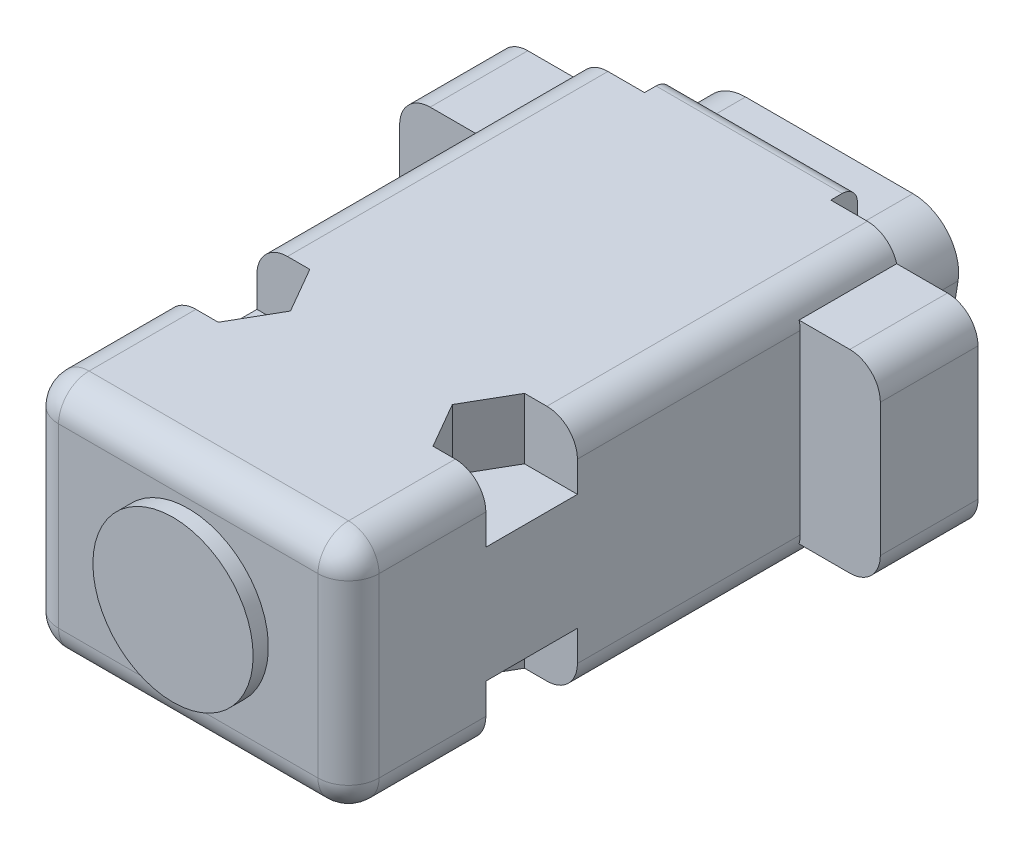
from build123d import *

# Parameters (mm, degrees)
EXTRUDE_1_DEPTH     = 7.8
SKETCH_3_R          = 5.25
EXTRUDE_2_DEPTH     = 1
SKETCH_5_W          = 31.5
SKETCH_5_H          = 6.4
EXTRUDE_3_DEPTH     = 6.35
EXTRUDE_4_DEPTH     = 6
FILLET_1_R          = 3
FILLET_2_R          = 2
FILLET_3_R          = 1
CUT_EXTRUDE_1_DEPTH = 4


with BuildPart() as part:
    # 草图1 → 凸台-拉伸1 (new, symmetric)
    with BuildSketch(Plane(origin=(0, 0, 0), x_dir=(1, 0, 0), z_dir=(0, 1, 0))):
        Polygon((-6.1, 18), (-10.5, 18), (-10.5, -18), (10.5, -18), (10.5, 18), (6.1, 18), (6.1, 19.75), (-6.1, 19.75), align=None)
    extrude(amount=EXTRUDE_1_DEPTH, both=True)

    # 草图3 → 凸台-拉伸2 (add)
    with BuildSketch(Plane.XY.offset(18)):
        with Locations(Location((0, 0, 0), (0, 0, 180))):
            Circle(SKETCH_3_R)
    extrude(amount=EXTRUDE_2_DEPTH)

    # 草图5 → 凸台-拉伸3 (add, symmetric)
    with BuildSketch(Plane(origin=(0, 0, 0), x_dir=(1, 0, 0), z_dir=(0, 1, 0))):
        with Locations((0, 14.8)):
            Rectangle(SKETCH_5_W, SKETCH_5_H)
    extrude(amount=EXTRUDE_3_DEPTH, both=True)

    # 草图6 → 凸台-拉伸4 (add)
    with BuildSketch(Plane(origin=(0, 0, -18), x_dir=(-1, 0, 0), z_dir=(0, 0, -1))):
        Polygon((-9, 4.85990087), (9, 4.85990087), (7.5, -4.54009913), (-7.5, -4.54009913), align=None)
    extrude(amount=EXTRUDE_4_DEPTH)

    # 圆角1
    fillet_1_edges = [part.edges().sort_by_distance(p)[0] for p in [
        (-7.5, -4.54009913, -21),
        (7.5, -4.54009913, -21),
        (9, 4.85990087, -21),
        (-9, 4.85990087, -21),
    ]]
    fillet(fillet_1_edges, radius=FILLET_1_R)

    # 圆角2
    # the kernel refuses this fillet: 2 mm, written as the material it takes off along each edge
    with BuildSketch(Plane(origin=(-8.5, -5.8, 16), x_dir=(-1, 0, 0), z_dir=(0, -1, 0))) as fillet_2_piece_1_section:
        Polygon((0, 0), (FILLET_2_R, 0), (FILLET_2_R, -FILLET_2_R), (0, -FILLET_2_R), align=None)
    fillet_2_piece_1 = extrude(amount=FILLET_2_R, mode=Mode.PRIVATE)
    fillet_2_piece_1 = fillet_2_piece_1 - Plane(origin=(-8.5, -5.8, 16), x_dir=(0.7071067811865474, 0, -0.7071067811865476), z_dir=(0, -1, 0)) * Sphere(FILLET_2_R, mode=Mode.PRIVATE)
    add(fillet_2_piece_1, mode=Mode.SUBTRACT)
    with BuildSketch(Plane(origin=(8.5, -5.8, 16), x_dir=(0, -1, 0), z_dir=(1, 0, 0))) as fillet_2_piece_2_section:
        Polygon((0, 0), (FILLET_2_R, 0), (FILLET_2_R, -FILLET_2_R), (0, -FILLET_2_R), align=None)
    fillet_2_piece_2 = extrude(amount=FILLET_2_R, mode=Mode.PRIVATE)
    fillet_2_piece_2 = fillet_2_piece_2 - Plane(origin=(8.5, -5.8, 16), x_dir=(0, 0.7071067811865475, -0.7071067811865475), z_dir=(1, 0, 0)) * Sphere(FILLET_2_R, mode=Mode.PRIVATE)
    add(fillet_2_piece_2, mode=Mode.SUBTRACT)
    with BuildSketch(Plane(origin=(8.5, 5.8, 16), x_dir=(0, 1, 0), z_dir=(1, 0, 0))) as fillet_2_piece_3_section:
        Polygon((0, 0), (FILLET_2_R, 0), (FILLET_2_R, FILLET_2_R), (0, FILLET_2_R), align=None)
    fillet_2_piece_3 = extrude(amount=FILLET_2_R, mode=Mode.PRIVATE)
    fillet_2_piece_3 = fillet_2_piece_3 - Plane(origin=(8.5, 5.8, 16), x_dir=(0, -0.7071067811865475, -0.7071067811865475), z_dir=(1, 0, 0)) * Sphere(FILLET_2_R, mode=Mode.PRIVATE)
    add(fillet_2_piece_3, mode=Mode.SUBTRACT)
    with BuildSketch(Plane(origin=(-8.5, 5.8, 16), x_dir=(-1, 0, 0), z_dir=(0, 1, 0))) as fillet_2_piece_4_section:
        Polygon((0, 0), (FILLET_2_R, 0), (FILLET_2_R, FILLET_2_R), (0, FILLET_2_R), align=None)
    fillet_2_piece_4 = extrude(amount=FILLET_2_R, mode=Mode.PRIVATE)
    fillet_2_piece_4 = fillet_2_piece_4 - Plane(origin=(-8.5, 5.8, 16), x_dir=(0.7071067811865474, 0, -0.7071067811865476), z_dir=(0, 1, 0)) * Sphere(FILLET_2_R, mode=Mode.PRIVATE)
    add(fillet_2_piece_4, mode=Mode.SUBTRACT)
    with BuildSketch(Plane(origin=(-8.5, -7.8, 18), x_dir=(0, 0, -1), z_dir=(1, 0, 0))) as fillet_2_piece_5:
        with BuildLine():
            CenterArc((FILLET_2_R, FILLET_2_R), FILLET_2_R, 180, 90)
            Line((0, FILLET_2_R), (0, 0))
            Line((0, 0), (FILLET_2_R, 0))
        make_face()
    extrude(amount=17, mode=Mode.SUBTRACT)
    with BuildSketch(Plane(origin=(10.5, -5.8, 18), x_dir=(-1, 0, 0), z_dir=(0, 1, 0)), Plane(origin=(-10.5, -5.8, 18), x_dir=(0, 0, -1), z_dir=(0, 1, 0))) as fillet_2_piece_6:
        with BuildLine():
            CenterArc((FILLET_2_R, -FILLET_2_R), FILLET_2_R, 90, 90)
            Line((0, -FILLET_2_R), (0, 0))
            Line((0, 0), (FILLET_2_R, 0))
        make_face()
    extrude(amount=11.6, mode=Mode.SUBTRACT)
    with BuildSketch(Plane(origin=(-8.5, 7.8, 18), x_dir=(0, 0, -1), z_dir=(1, 0, 0))) as fillet_2_piece_7:
        with BuildLine():
            CenterArc((FILLET_2_R, -FILLET_2_R), FILLET_2_R, 90, 90)
            Line((0, -FILLET_2_R), (0, 0))
            Line((0, 0), (FILLET_2_R, 0))
        make_face()
    extrude(amount=17, mode=Mode.SUBTRACT)
    with BuildSketch(Plane(origin=(-10.5, -7.8, -23), x_dir=(1, 0, 0), z_dir=(0, 0, 1))) as fillet_2_piece_8_section:
        with BuildLine():
            CenterArc((FILLET_2_R, FILLET_2_R), FILLET_2_R, 180, 90)
            Line((0, FILLET_2_R), (0, 0))
            Line((0, 0), (FILLET_2_R, 0))
        make_face()
    fillet_2_piece_8 = extrude(amount=39, mode=Mode.PRIVATE)
    fillet_2_piece_8 = split(fillet_2_piece_8, bisect_by=Plane(origin=(-10.030513344, -6.35, -17.3), z_dir=(0, -1, 0)), keep=Keep.TOP, mode=Mode.PRIVATE)
    fillet_2_piece_8 = split(fillet_2_piece_8, bisect_by=Plane(origin=(-10.030513344, -7.391821247, -11.6), z_dir=(0, 0, -1)), keep=Keep.TOP, mode=Mode.PRIVATE)
    add(fillet_2_piece_8, mode=Mode.SUBTRACT)
    with BuildSketch(Plane(origin=(-10.5, -7.8, -23), x_dir=(1, 0, 0), z_dir=(0, 0, 1))) as fillet_2_piece_9_section:
        with BuildLine():
            CenterArc((FILLET_2_R, FILLET_2_R), FILLET_2_R, 180, 90)
            Line((0, FILLET_2_R), (0, 0))
            Line((0, 0), (FILLET_2_R, 0))
        make_face()
    fillet_2_piece_9 = extrude(amount=39, mode=Mode.PRIVATE)
    fillet_2_piece_9 = split(fillet_2_piece_9, bisect_by=Plane(origin=(-10.030513344, -6.35, 2.2), z_dir=(0, -1, 0)), keep=Keep.TOP, mode=Mode.PRIVATE)
    fillet_2_piece_9 = split(fillet_2_piece_9, bisect_by=Plane(origin=(-10.030513344, -7.391821247, -11.6), z_dir=(0, 0, 1)), keep=Keep.TOP, mode=Mode.PRIVATE)
    add(fillet_2_piece_9, mode=Mode.SUBTRACT)
    with BuildSketch(Plane(origin=(-10.5, -7.8, -23), x_dir=(1, 0, 0), z_dir=(0, 0, 1))) as fillet_2_piece_10_section:
        with BuildLine():
            CenterArc((FILLET_2_R, FILLET_2_R), FILLET_2_R, 180, 90)
            Line((0, FILLET_2_R), (0, 0))
            Line((0, 0), (FILLET_2_R, 0))
        make_face()
    fillet_2_piece_10 = extrude(amount=39, mode=Mode.PRIVATE)
    fillet_2_piece_10 = split(fillet_2_piece_10, bisect_by=Plane(origin=(-10.503237221, -6.35, 2.2), z_dir=(0, 1, 0)), keep=Keep.TOP, mode=Mode.PRIVATE)
    fillet_2_piece_10 = split(fillet_2_piece_10, bisect_by=Plane(origin=(-10.503237221, -6.128742069, -11.6), z_dir=(0, 0, 1)), keep=Keep.TOP, mode=Mode.PRIVATE)
    add(fillet_2_piece_10, mode=Mode.SUBTRACT)
    with BuildSketch(Plane(origin=(-10.5, 7.8, -23), x_dir=(0, -1, 0), z_dir=(0, 0, 1))) as fillet_2_piece_11_section:
        with BuildLine():
            CenterArc((FILLET_2_R, FILLET_2_R), FILLET_2_R, 180, 90)
            Line((0, FILLET_2_R), (0, 0))
            Line((0, 0), (FILLET_2_R, 0))
        make_face()
    fillet_2_piece_11 = extrude(amount=39, mode=Mode.PRIVATE)
    fillet_2_piece_11 = split(fillet_2_piece_11, bisect_by=Plane(origin=(-10.030513344, 7.391821247, -11.6), z_dir=(0, 0, -1)), keep=Keep.TOP, mode=Mode.PRIVATE)
    fillet_2_piece_11 = split(fillet_2_piece_11, bisect_by=Plane(origin=(-10.030513344, 6.35, -17.3), z_dir=(0, 1, 0)), keep=Keep.TOP, mode=Mode.PRIVATE)
    add(fillet_2_piece_11, mode=Mode.SUBTRACT)
    with BuildSketch(Plane(origin=(-10.5, 7.8, -23), x_dir=(0, -1, 0), z_dir=(0, 0, 1))) as fillet_2_piece_12_section:
        with BuildLine():
            CenterArc((FILLET_2_R, FILLET_2_R), FILLET_2_R, 180, 90)
            Line((0, FILLET_2_R), (0, 0))
            Line((0, 0), (FILLET_2_R, 0))
        make_face()
    fillet_2_piece_12 = extrude(amount=39, mode=Mode.PRIVATE)
    fillet_2_piece_12 = split(fillet_2_piece_12, bisect_by=Plane(origin=(-10.503237221, 6.128742069, -11.6), z_dir=(0, 0, 1)), keep=Keep.TOP, mode=Mode.PRIVATE)
    fillet_2_piece_12 = split(fillet_2_piece_12, bisect_by=Plane(origin=(-10.503237221, 6.35, 2.2), z_dir=(0, -1, 0)), keep=Keep.TOP, mode=Mode.PRIVATE)
    add(fillet_2_piece_12, mode=Mode.SUBTRACT)
    with BuildSketch(Plane(origin=(-10.5, 7.8, -23), x_dir=(0, -1, 0), z_dir=(0, 0, 1))) as fillet_2_piece_13_section:
        with BuildLine():
            CenterArc((FILLET_2_R, FILLET_2_R), FILLET_2_R, 180, 90)
            Line((0, FILLET_2_R), (0, 0))
            Line((0, 0), (FILLET_2_R, 0))
        make_face()
    fillet_2_piece_13 = extrude(amount=39, mode=Mode.PRIVATE)
    fillet_2_piece_13 = split(fillet_2_piece_13, bisect_by=Plane(origin=(-10.030513344, 7.391821247, -11.6), z_dir=(0, 0, 1)), keep=Keep.TOP, mode=Mode.PRIVATE)
    fillet_2_piece_13 = split(fillet_2_piece_13, bisect_by=Plane(origin=(-10.030513344, 6.35, 2.2), z_dir=(0, 1, 0)), keep=Keep.TOP, mode=Mode.PRIVATE)
    add(fillet_2_piece_13, mode=Mode.SUBTRACT)
    with BuildSketch(Plane(origin=(10.5, 7.8, 16), x_dir=(-1, 0, 0), z_dir=(0, 0, -1))) as fillet_2_piece_14_section:
        with BuildLine():
            CenterArc((FILLET_2_R, -FILLET_2_R), FILLET_2_R, 90, 90)
            Line((0, -FILLET_2_R), (0, 0))
            Line((0, 0), (FILLET_2_R, 0))
        make_face()
    fillet_2_piece_14 = extrude(amount=39, mode=Mode.PRIVATE)
    fillet_2_piece_14 = split(fillet_2_piece_14, bisect_by=Plane(origin=(10.030513344, 6.35, 2.2), z_dir=(0, 1, 0)), keep=Keep.TOP, mode=Mode.PRIVATE)
    fillet_2_piece_14 = split(fillet_2_piece_14, bisect_by=Plane(origin=(10.030513344, 7.391821247, -11.6), z_dir=(0, 0, 1)), keep=Keep.TOP, mode=Mode.PRIVATE)
    add(fillet_2_piece_14, mode=Mode.SUBTRACT)
    with BuildSketch(Plane(origin=(10.5, 7.8, 16), x_dir=(-1, 0, 0), z_dir=(0, 0, -1))) as fillet_2_piece_15_section:
        with BuildLine():
            CenterArc((FILLET_2_R, -FILLET_2_R), FILLET_2_R, 90, 90)
            Line((0, -FILLET_2_R), (0, 0))
            Line((0, 0), (FILLET_2_R, 0))
        make_face()
    fillet_2_piece_15 = extrude(amount=39, mode=Mode.PRIVATE)
    fillet_2_piece_15 = split(fillet_2_piece_15, bisect_by=Plane(origin=(10.503237221, 6.35, 2.2), z_dir=(0, -1, 0)), keep=Keep.TOP, mode=Mode.PRIVATE)
    fillet_2_piece_15 = split(fillet_2_piece_15, bisect_by=Plane(origin=(10.503237221, 6.128742069, -11.6), z_dir=(0, 0, 1)), keep=Keep.TOP, mode=Mode.PRIVATE)
    add(fillet_2_piece_15, mode=Mode.SUBTRACT)
    with BuildSketch(Plane(origin=(10.5, 7.8, 16), x_dir=(-1, 0, 0), z_dir=(0, 0, -1))) as fillet_2_piece_16_section:
        with BuildLine():
            CenterArc((FILLET_2_R, -FILLET_2_R), FILLET_2_R, 90, 90)
            Line((0, -FILLET_2_R), (0, 0))
            Line((0, 0), (FILLET_2_R, 0))
        make_face()
    fillet_2_piece_16 = extrude(amount=39, mode=Mode.PRIVATE)
    fillet_2_piece_16 = split(fillet_2_piece_16, bisect_by=Plane(origin=(10.030513344, 6.35, -17.3), z_dir=(0, 1, 0)), keep=Keep.TOP, mode=Mode.PRIVATE)
    fillet_2_piece_16 = split(fillet_2_piece_16, bisect_by=Plane(origin=(10.030513344, 7.391821247, -11.6), z_dir=(0, 0, -1)), keep=Keep.TOP, mode=Mode.PRIVATE)
    add(fillet_2_piece_16, mode=Mode.SUBTRACT)
    with BuildSketch(Plane(origin=(10.5, -7.8, 16), x_dir=(-1, 0, 0), z_dir=(0, 0, -1))) as fillet_2_piece_17_section:
        with BuildLine():
            CenterArc((FILLET_2_R, FILLET_2_R), FILLET_2_R, 180, 90)
            Line((0, FILLET_2_R), (0, 0))
            Line((0, 0), (FILLET_2_R, 0))
        make_face()
    fillet_2_piece_17 = extrude(amount=39, mode=Mode.PRIVATE)
    fillet_2_piece_17 = split(fillet_2_piece_17, bisect_by=Plane(origin=(10.030513344, -7.391821247, -11.6), z_dir=(0, 0, 1)), keep=Keep.TOP, mode=Mode.PRIVATE)
    fillet_2_piece_17 = split(fillet_2_piece_17, bisect_by=Plane(origin=(10.030513344, -6.35, 2.2), z_dir=(0, -1, 0)), keep=Keep.TOP, mode=Mode.PRIVATE)
    add(fillet_2_piece_17, mode=Mode.SUBTRACT)
    with BuildSketch(Plane(origin=(10.5, -7.8, 16), x_dir=(-1, 0, 0), z_dir=(0, 0, -1))) as fillet_2_piece_18_section:
        with BuildLine():
            CenterArc((FILLET_2_R, FILLET_2_R), FILLET_2_R, 180, 90)
            Line((0, FILLET_2_R), (0, 0))
            Line((0, 0), (FILLET_2_R, 0))
        make_face()
    fillet_2_piece_18 = extrude(amount=39, mode=Mode.PRIVATE)
    fillet_2_piece_18 = split(fillet_2_piece_18, bisect_by=Plane(origin=(10.503237221, -6.128742069, -11.6), z_dir=(0, 0, 1)), keep=Keep.TOP, mode=Mode.PRIVATE)
    fillet_2_piece_18 = split(fillet_2_piece_18, bisect_by=Plane(origin=(10.503237221, -6.35, 2.2), z_dir=(0, 1, 0)), keep=Keep.TOP, mode=Mode.PRIVATE)
    add(fillet_2_piece_18, mode=Mode.SUBTRACT)
    with BuildSketch(Plane(origin=(10.5, -7.8, 16), x_dir=(-1, 0, 0), z_dir=(0, 0, -1))) as fillet_2_piece_19_section:
        with BuildLine():
            CenterArc((FILLET_2_R, FILLET_2_R), FILLET_2_R, 180, 90)
            Line((0, FILLET_2_R), (0, 0))
            Line((0, 0), (FILLET_2_R, 0))
        make_face()
    fillet_2_piece_19 = extrude(amount=39, mode=Mode.PRIVATE)
    fillet_2_piece_19 = split(fillet_2_piece_19, bisect_by=Plane(origin=(10.030513344, -7.391821247, -11.6), z_dir=(0, 0, -1)), keep=Keep.TOP, mode=Mode.PRIVATE)
    fillet_2_piece_19 = split(fillet_2_piece_19, bisect_by=Plane(origin=(10.030513344, -6.35, -17.3), z_dir=(0, -1, 0)), keep=Keep.TOP, mode=Mode.PRIVATE)
    add(fillet_2_piece_19, mode=Mode.SUBTRACT)
    with BuildSketch(Plane(origin=(15.75, -6.35, -23), x_dir=(-1, 0, 0), z_dir=(0, 0, 1)), Plane(origin=(-15.75, 6.35, -6.6), x_dir=(0, -1, 0), z_dir=(0, 0, -1)), Plane(origin=(-15.75, -6.35, -6.6), x_dir=(1, 0, 0), z_dir=(0, 0, -1))) as fillet_2_piece_20:
        with BuildLine():
            CenterArc((FILLET_2_R, -FILLET_2_R), FILLET_2_R, 90, 90)
            Line((0, -FILLET_2_R), (0, 0))
            Line((0, 0), (FILLET_2_R, 0))
        make_face()
    extrude(amount=16.4, mode=Mode.SUBTRACT)
    with BuildSketch(Plane(origin=(15.75, 6.35, -23), x_dir=(-1, 0, 0), z_dir=(0, 0, 1))) as fillet_2_piece_21:
        with BuildLine():
            CenterArc((FILLET_2_R, FILLET_2_R), FILLET_2_R, 180, 90)
            Line((0, FILLET_2_R), (0, 0))
            Line((0, 0), (FILLET_2_R, 0))
        make_face()
    extrude(amount=16.4, mode=Mode.SUBTRACT)

    # 圆角3
    fillet_3_edges = [part.edges().sort_by_distance(p)[0] for p in [
        (0, 7.8, -19.75),
        (0, -7.8, -19.75),
    ]]
    fillet(fillet_3_edges, radius=FILLET_3_R)

    # 草图7 → 切除-拉伸1 (cut)
    with BuildSketch(Plane(origin=(0, 7.8, 0), x_dir=(1, 0, 0), z_dir=(0, 1, 0))):
        Polygon((-12.232050808, -6), (-10.5, -9), (-7.035898385, -9), (-5.303847577, -6), (-7.035898385, -3), (-10.5, -3), align=None)
        Polygon((10.5, -3), (12.232050808, -6), (10.5, -9), (7.035898385, -9), (5.303847577, -6), (7.035898385, -3), align=None)
    cut_extrude_1 = extrude(amount=-CUT_EXTRUDE_1_DEPTH, mode=Mode.SUBTRACT)

    # 镜向1: 切除-拉伸1 across plane
    add(cut_extrude_1.mirror(Plane.ZX), mode=Mode.SUBTRACT)


solid = part.part
